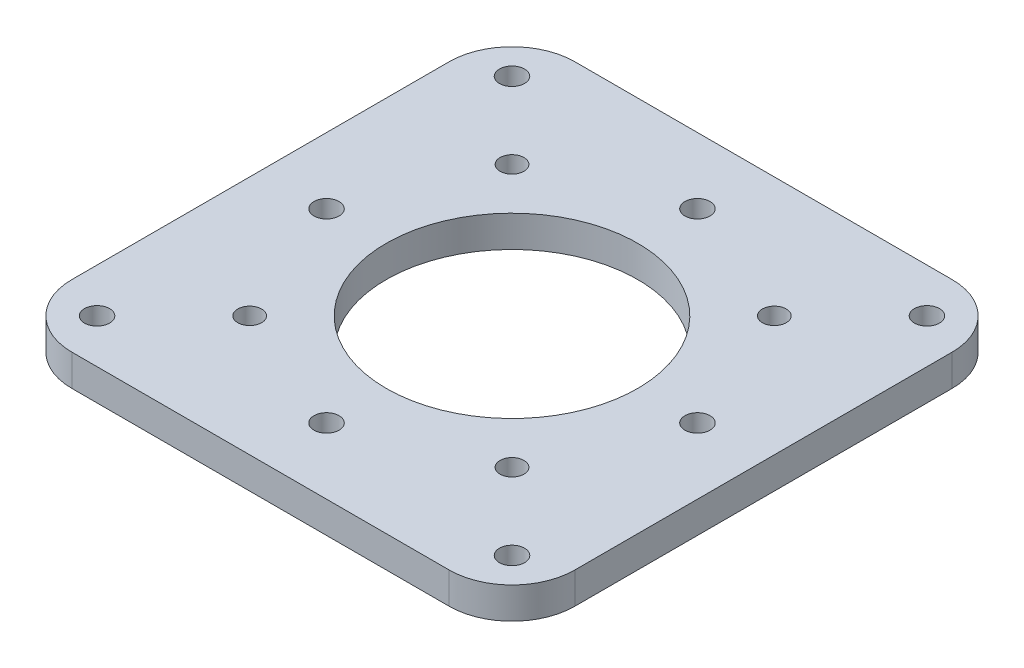
from build123d import *

# Parameters (mm, degrees)
SKETCH_1_W      = 80
SKETCH_1_H      = 80
SKETCH_1_R      = 1.9
SKETCH_1_R_2    = 2
SKETCH_1_R_3    = 20
EXTRUDE_1_DEPTH = 5
FILLET_5_R      = 10


with BuildPart() as part:
    # Эскиз1 → Бобышка-Вытянуть1 (new body)
    with BuildSketch(Plane(origin=(0, 0, 0), x_dir=(1, 0, 0), z_dir=(0, 1, 0))):
        Rectangle(SKETCH_1_W, SKETCH_1_H)
        with Locations((20.859650045, 20.859650045)):
            Circle(SKETCH_1_R, mode=Mode.SUBTRACT)
        with Locations((20.859650045, -20.859650045)):
            Circle(SKETCH_1_R, mode=Mode.SUBTRACT)
        with Locations((-20.859650045, -20.859650045)):
            Circle(SKETCH_1_R, mode=Mode.SUBTRACT)
        with Locations((-20.859650045, 20.859650045)):
            Circle(SKETCH_1_R, mode=Mode.SUBTRACT)
        with Locations((-33, 33)):
            Circle(SKETCH_1_R_2, mode=Mode.SUBTRACT)
        with Locations((33, 33)):
            Circle(SKETCH_1_R_2, mode=Mode.SUBTRACT)
        with Locations((33, -33)):
            Circle(SKETCH_1_R_2, mode=Mode.SUBTRACT)
        with Locations((-33, -33)):
            Circle(SKETCH_1_R_2, mode=Mode.SUBTRACT)
        Circle(SKETCH_1_R_3, mode=Mode.SUBTRACT)
        with Locations((0, 29.5)):
            Circle(SKETCH_1_R_2, mode=Mode.SUBTRACT)
        with Locations((29.5, 0)):
            Circle(SKETCH_1_R_2, mode=Mode.SUBTRACT)
        with Locations((0, -29.5)):
            Circle(SKETCH_1_R_2, mode=Mode.SUBTRACT)
        with Locations((-29.5, 0)):
            Circle(SKETCH_1_R_2, mode=Mode.SUBTRACT)
    extrude(amount=EXTRUDE_1_DEPTH)

    # Скругление5
    fillet_5_edges = [part.edges().sort_by_distance(p)[0] for p in [
        (-40, 2.5, -40),
        (40, 2.5, -40),
        (-40, 2.5, 40),
        (40, 2.5, 40),
    ]]
    fillet(fillet_5_edges, radius=FILLET_5_R)


solid = part.part
